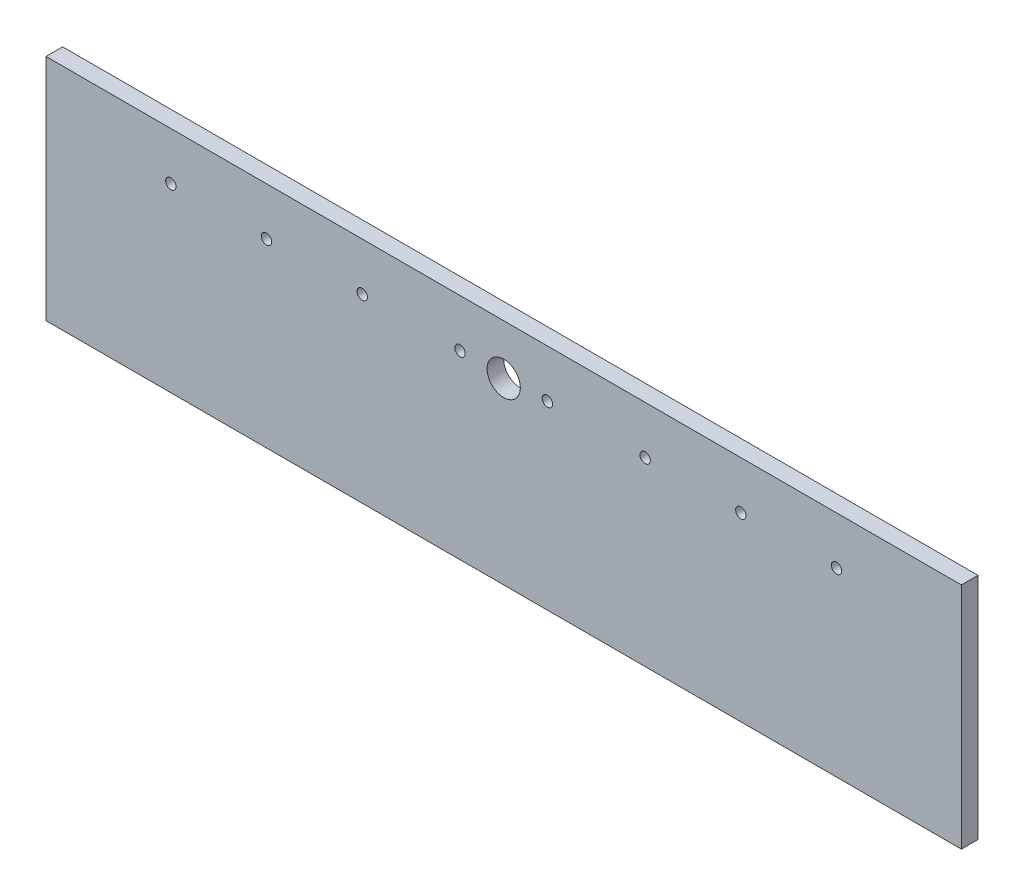
from build123d import *

# Parameters (mm, degrees)
SKETCH1_W           = 1397
SKETCH1_H           = 349.25
SKETCH1_R           = 25.4
SKETCH1_R_2         = 7.9375
BOSS_EXTRUDE1_DEPTH = 25.4


with BuildPart() as part:
    # Sketch1 → Boss-Extrude1 (new body)
    with BuildSketch(Plane.XY):
        with Locations((698.5, 174.625)):
            Rectangle(SKETCH1_W, SKETCH1_H)
        with Locations((698.5, 273.05)):
            Circle(SKETCH1_R, mode=Mode.SUBTRACT)
        with Locations((190.5, 276.225)):
            Circle(SKETCH1_R_2, mode=Mode.SUBTRACT)
        with Locations((336.55, 276.225)):
            Circle(SKETCH1_R_2, mode=Mode.SUBTRACT)
        with Locations((482.6, 276.225)):
            Circle(SKETCH1_R_2, mode=Mode.SUBTRACT)
        with Locations((631.825, 276.225)):
            Circle(SKETCH1_R_2, mode=Mode.SUBTRACT)
        with Locations((1206.5, 276.225)):
            Circle(SKETCH1_R_2, mode=Mode.SUBTRACT)
        with Locations((1060.45, 276.225)):
            Circle(SKETCH1_R_2, mode=Mode.SUBTRACT)
        with Locations((914.4, 276.225)):
            Circle(SKETCH1_R_2, mode=Mode.SUBTRACT)
        with Locations((765.175, 276.225)):
            Circle(SKETCH1_R_2, mode=Mode.SUBTRACT)
    extrude(amount=BOSS_EXTRUDE1_DEPTH)


solid = part.part
